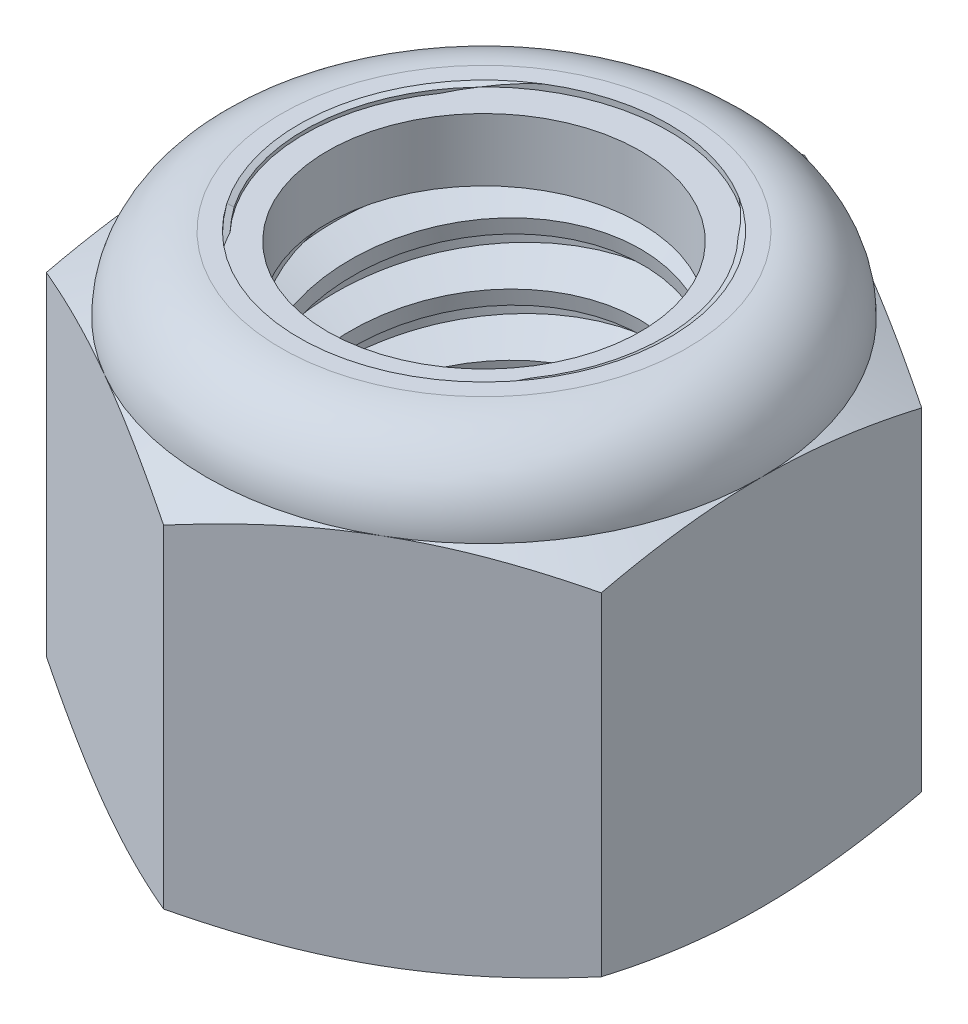
from build123d import *

# Parameters (mm, degrees)
EXTRUDE1_DEPTH       = 11.509375
SKETCH2_W            = 4.7625
SKETCH2_H            = 11.509375
LPATTERN1_COUNT      = 7
LPATTERN1_PITCH      = 1.5875
LPATTERN1_COUNT_DIR2 = 2
LPATTERN1_PITCH_DIR2 = 1.5875


with BuildPart() as part:
    # Sketch1 → Extrude1 (new body)
    with BuildSketch(Plane(origin=(0, 0, 0), x_dir=(1, 0, 0), z_dir=(0, 1, 0))):
        Polygon((0, 8.248891971), (-7.14375, 4.124445986), (-7.14375, -4.124445986), (0, -8.248891971), (7.14375, -4.124445986), (7.14375, 4.124445986), align=None)
    extrude(amount=EXTRUDE1_DEPTH)

    # Sketch4 → Cut-Revolve2 (revolve, cut)
    with BuildSketch(Plane(origin=(0, 0, 0), x_dir=(0, 0, -1), z_dir=(1, 0, 0))):
        Polygon((0, 11.509375), (4.7625, 11.509375), (4.029111805, 11.167390468), (4.029111805, 0.341984532), (4.7625, 0), (0, 0), align=None)
    revolve(axis=Axis((0, 11.509375, 0), (0, 1, 0)), mode=Mode.SUBTRACT)


with BuildPart() as body_2:
    # Sketch2 → Revolve1 (revolve)
    with BuildSketch(Plane(origin=(0, 0, 0), x_dir=(0, 0, -1), z_dir=(1, 0, 0))):
        with Locations((2.38125, 5.7546875)):
            Rectangle(SKETCH2_W, SKETCH2_H)
    revolve(axis=Axis((0, -4.7625, 0), (0, 1, 0)))

    # Sketch3 → Cut-Revolve1 (revolve, cut)
    with BuildSketch(Plane(origin=(0, 0, 0), x_dir=(0, 0, -1), z_dir=(1, 0, 0))):
        Polygon((4.795122924, 11.313637456), (5.023483392, 9.943474646), (4.094357653, 10.291557102), (4.029111805, 10.68303219), align=None)
    cut_revolve1 = revolve(axis=Axis((0, 11.509375, 0.28317269), (0, -0.9863939238321437, -0.16439898730535765)), mode=Mode.SUBTRACT)

    # LPattern1: Cut-Revolve1 7 × 2
    with Locations(*[Vector(0, -1, 0) * (i * LPATTERN1_PITCH) + Vector(0, 1, 0) * (j * LPATTERN1_PITCH_DIR2) for i in range(LPATTERN1_COUNT) for j in range(LPATTERN1_COUNT_DIR2) if (i, j) != (0, 0)]):
        add(cut_revolve1, mode=Mode.SUBTRACT)


with BuildPart() as part_1:
    add(part.part)

    # Combine1: cut body 2
    add(body_2.part, mode=Mode.SUBTRACT)

    # Sketch5 → Cut-Revolve3 (revolve, cut)
    with BuildSketch(Plane(origin=(0, 0, 0), x_dir=(0, 0, -1), z_dir=(1, 0, 0))):
        with BuildLine():
            Line((0, 0), (7.14375, 0))
            Line((7.14375, 0), (8.248891971, 0.515336164))
            Line((8.248891971, 0.515336164), (8.248891971, 9.075809669))
            Line((8.248891971, 9.075809669), (7.14375, 9.591145833))
            ThreePointArc((7.14375, 9.591145833), (6.581913685, 10.947538685), (5.225520833, 11.509375))
            Line((5.225520833, 11.509375), (5.225520833, 12.779375))
            Line((5.225520833, 12.779375), (9.518891971, 12.779375))
            Line((9.518891971, 12.779375), (9.518891971, -1.27))
            Line((9.518891971, -1.27), (0, -1.27))
            Line((0, -1.27), (0, 0))
        make_face()
    revolve(axis=Axis((0, 0, 0), (0, 1, 0)), mode=Mode.SUBTRACT)

    # Sketch6 → Cut-Revolve4 (revolve, cut)
    with BuildSketch(Plane(origin=(0, 0, 0), x_dir=(0, 0, -1), z_dir=(1, 0, 0))):
        with BuildLine():
            Line((0, 9.591145833), (6.99135, 9.591145833))
            ThreePointArc((6.99135, 9.591145833), (6.474150612, 10.839775612), (5.225520833, 11.356975))
            Line((5.225520833, 11.356975), (4.627316319, 11.356975))
            Line((4.627316319, 11.356975), (4.627316319, 12.779375))
            Line((4.627316319, 12.779375), (0, 12.779375))
            Line((0, 12.779375), (0, 9.591145833))
        make_face()
    revolve(axis=Axis((0, 12.779375, 0), (0, 1, 0)), mode=Mode.SUBTRACT)


with BuildPart() as body_2_2:
    # Sketch7 → Revolve2 (revolve)
    with BuildSketch(Plane(origin=(0, 0, 0), x_dir=(0, 0, -1), z_dir=(1, 0, 0))):
        with BuildLine():
            Line((4.029111805, 9.667345833), (6.913430867, 9.667345833))
            ThreePointArc((6.913430867, 9.667345833), (6.39301751, 10.812537757), (5.225520833, 11.280775))
            Line((5.225520833, 11.280775), (4.029111805, 11.280775))
            Line((4.029111805, 11.280775), (4.029111805, 9.667345833))
        make_face()
    revolve(axis=Axis((0, 9.667345833, 0), (0, 1, 0)))


solid = Compound([part_1.part, body_2_2.part])
